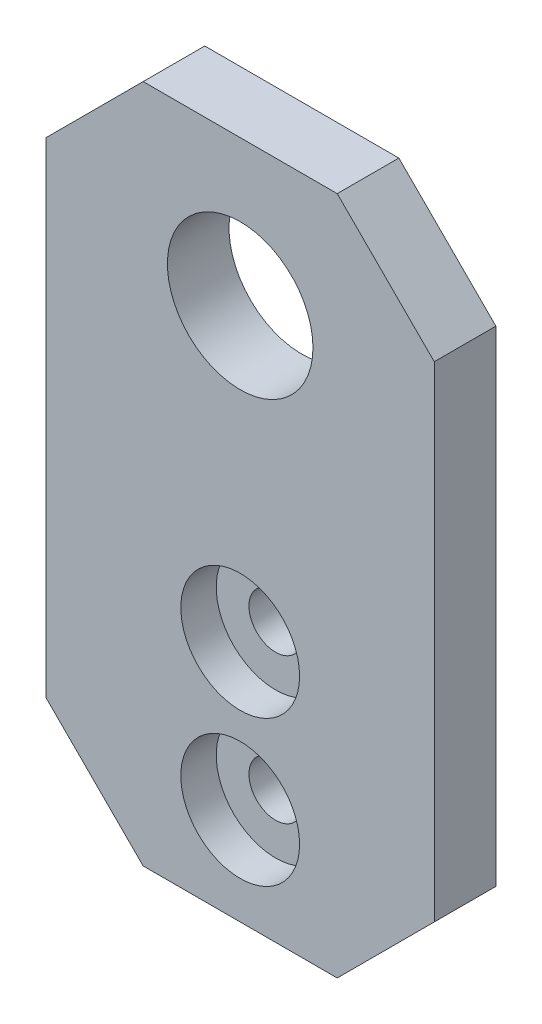
from build123d import *

# Parameters (mm, degrees)
SKETCH1_W                                    = 40
SKETCH1_H                                    = 70
SKETCH1_R                                    = 7.5
BOSS_EXTRUDE1_DEPTH                          = 6.35
CBORE_FOR_M5_HEX_HEAD_CAP_SCREW1_D           = 5.5
CBORE_FOR_M5_HEX_HEAD_CAP_SCREW1_CBORE_D     = 12.24
CBORE_FOR_M5_HEX_HEAD_CAP_SCREW1_CBORE_DEPTH = 3.65
CHAMFER1_SIZE                                = 10


with BuildPart() as part:
    # Sketch1 → Boss-Extrude1 (new body)
    with BuildSketch(Plane.XY):
        Rectangle(SKETCH1_W, SKETCH1_H)
        with Locations((0, 20)):
            Circle(SKETCH1_R, mode=Mode.SUBTRACT)
    extrude(amount=BOSS_EXTRUDE1_DEPTH)

    # CBORE for M5 Hex Head Cap Screw1 (through all)
    with Locations(Plane.XY.offset(6.35)):
        with Locations((0, -10), (0, -25)):
            CounterBoreHole(CBORE_FOR_M5_HEX_HEAD_CAP_SCREW1_D / 2, CBORE_FOR_M5_HEX_HEAD_CAP_SCREW1_CBORE_D / 2, CBORE_FOR_M5_HEX_HEAD_CAP_SCREW1_CBORE_DEPTH)

    # Chamfer1
    chamfer1_edges = [part.edges().sort_by_distance(p)[0] for p in [
        (20, -35, 3.175),
        (-20, -35, 3.175),
        (20, 35, 3.175),
        (-20, 35, 3.175),
    ]]
    chamfer(chamfer1_edges, length=CHAMFER1_SIZE)


solid = part.part
